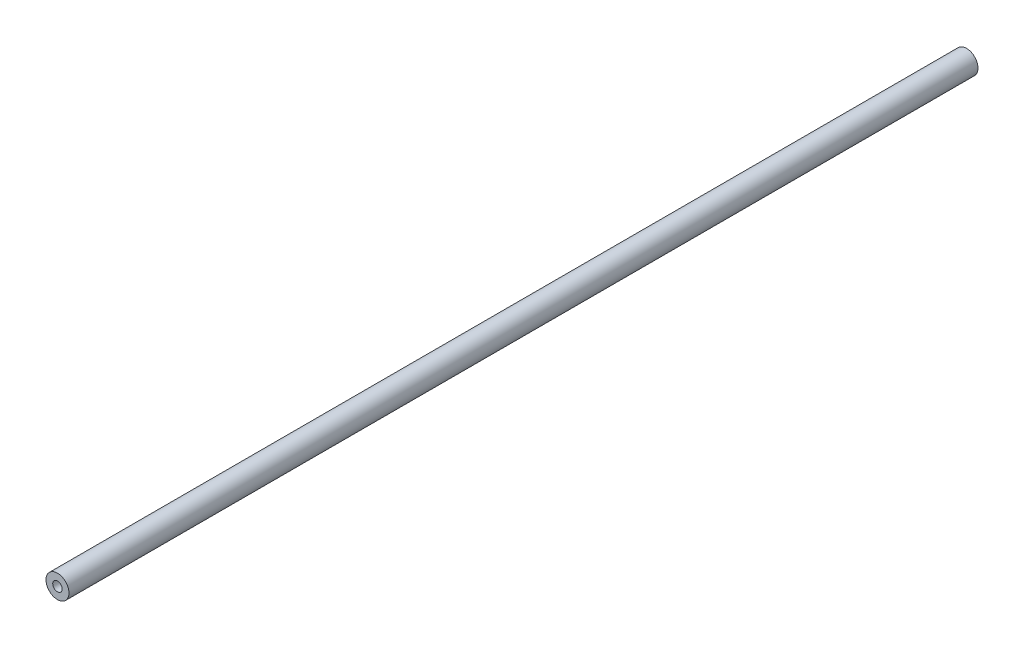
from build123d import *

# Parameters (mm, degrees)
SKETCH_1_R      = 4
EXTRUDE_1_DEPTH = 158.2
M4X0_72_D       = 3.3
M4X0_72_DEPTH   = 19
M4X0_72_TIP     = 0.991420021
M4X0_71_D       = 3.3
M4X0_71_DEPTH   = 19
M4X0_71_TIP     = 0.991420021


with BuildPart() as part:
    # Эскиз1 → Бобышка-Вытянуть1 (new, symmetric)
    with BuildSketch(Plane.XY):
        Circle(SKETCH_1_R)
    extrude(amount=EXTRUDE_1_DEPTH, both=True)

    # Отверстие обработанное метчиком M4x0.72
    with Locations(Plane(origin=(0, 0, -158.2), x_dir=(-1, 0, 0), z_dir=(0, 0, -1))):
        with Locations((0, 0)):
            Hole(M4X0_72_D / 2, depth=M4X0_72_DEPTH)
            with Locations((0, 0, -(M4X0_72_DEPTH + M4X0_72_TIP / 2))):  # 118° drill point
                Cone(0, M4X0_72_D / 2, M4X0_72_TIP, mode=Mode.SUBTRACT)

    # Отверстие обработанное метчиком M4x0.71
    with Locations(Plane.XY.offset(158.2)):
        with Locations((0, 0)):
            Hole(M4X0_71_D / 2, depth=M4X0_71_DEPTH)
            with Locations((0, 0, -(M4X0_71_DEPTH + M4X0_71_TIP / 2))):  # 118° drill point
                Cone(0, M4X0_71_D / 2, M4X0_71_TIP, mode=Mode.SUBTRACT)


solid = part.part
